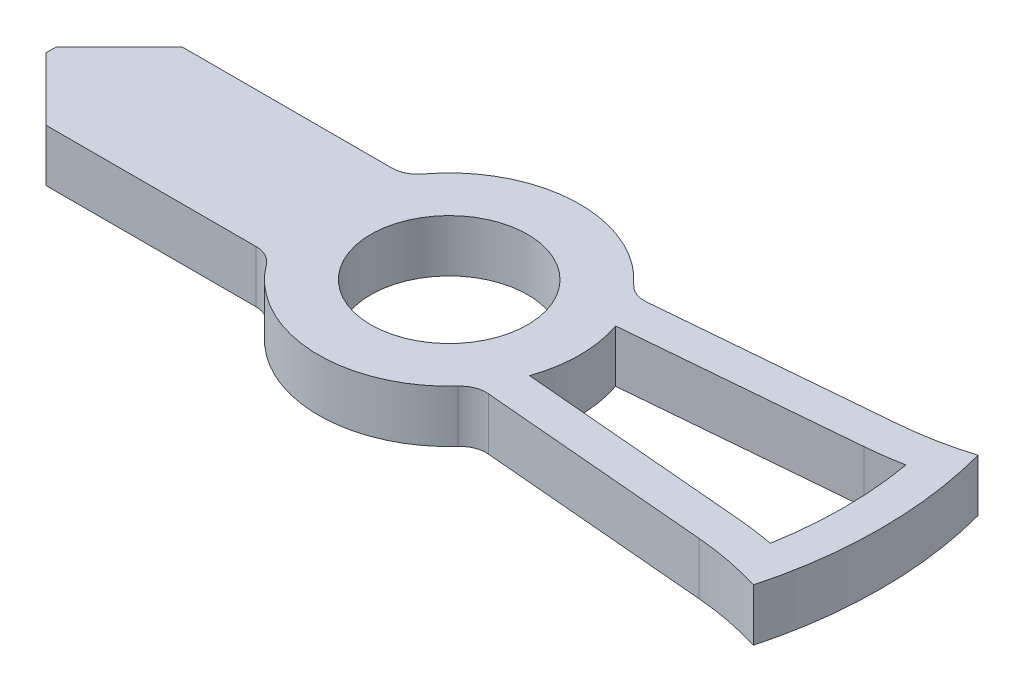
from build123d import *

# Parameters (mm, degrees)
SKETCH1_R           = 0.0381
BOSS_EXTRUDE1_DEPTH = 10
SKETCH3_R           = 15
CUT_EXTRUDE3_DEPTH  = 10
FILLET4_R           = 5
CHAMFER1_SIZE       = 12


with BuildPart() as part:
    # Sketch1 → Boss-Extrude1 (new body)
    with BuildSketch(Plane(origin=(0, 0, 0), x_dir=(1, 0, 0), z_dir=(0, 1, 0))):
        with BuildLine():
            ThreePointArc((79.705997622, 21.48153726), (73.301280343, 19.892570276), (66.765542466, 18.981883778))
            Line((66.765542466, 18.981883778), (20.037726899, 14.949565235))
            ThreePointArc((20.037726899, 14.949565235), (-1.176200611, 24.972315714), (-21.354156504, 13))
            Line((-21.354156504, 13), (-76.154156504, 13))
            Line((-76.154156504, 13), (-76.154156504, -13))
            Line((-76.154156504, -13), (-21.354156504, -13))
            ThreePointArc((-21.354156504, -13), (-1.176200611, -24.972315714), (20.037726899, -14.949565235))
            Line((20.037726899, -14.949565235), (66.765542466, -18.981883778))
            ThreePointArc((66.765542466, -18.981883778), (73.301280343, -19.892570276), (79.705997622, -21.48153726))
            ThreePointArc((79.705997622, -21.48153726), (82.55, 0), (79.705997622, 21.48153726))
        make_face()
        Circle(SKETCH1_R, mode=Mode.SUBTRACT)
        with BuildLine():
            Line((23.605993088, 8.231469513), (67.36736213, 12.007802255))
            ThreePointArc((67.36736213, 12.007802255), (70.909303379, 12.404475941), (74.426477633, 12.980829216))
            ThreePointArc((74.426477633, 12.980829216), (75.55, 0), (74.426477633, -12.980829216))
            ThreePointArc((74.426477633, -12.980829216), (70.909303379, -12.404475941), (67.36736213, -12.007802255))
            Line((67.36736213, -12.007802255), (23.605993088, -8.231469513))
            ThreePointArc((23.605993088, -8.231469513), (25, 0), (23.605993088, 8.231469513))
        make_face(mode=Mode.SUBTRACT)
    extrude(amount=BOSS_EXTRUDE1_DEPTH)

    # Sketch3 → Cut-Extrude3 (cut)
    with BuildSketch(Plane(origin=(0, 10, 0), x_dir=(1, 0, 0), z_dir=(0, 1, 0))):
        Circle(SKETCH3_R)
    extrude(amount=-CUT_EXTRUDE3_DEPTH, mode=Mode.SUBTRACT)

    # Fillet4
    fillet4_edges = [part.edges().sort_by_distance(p)[0] for p in [
        (20.037726899, 5, 14.949565235),
        (-21.354156504, 5, 13),
        (-21.354156504, 5, -13),
        (20.037726899, 5, -14.949565235),
    ]]
    fillet(fillet4_edges, radius=FILLET4_R)

    # Chamfer1
    chamfer1_edges = [part.edges().sort_by_distance(p)[0] for p in [
        (-76.154156504, 5, -13),
        (-76.154156504, 5, 13),
    ]]
    chamfer(chamfer1_edges, length=CHAMFER1_SIZE)


solid = part.part
